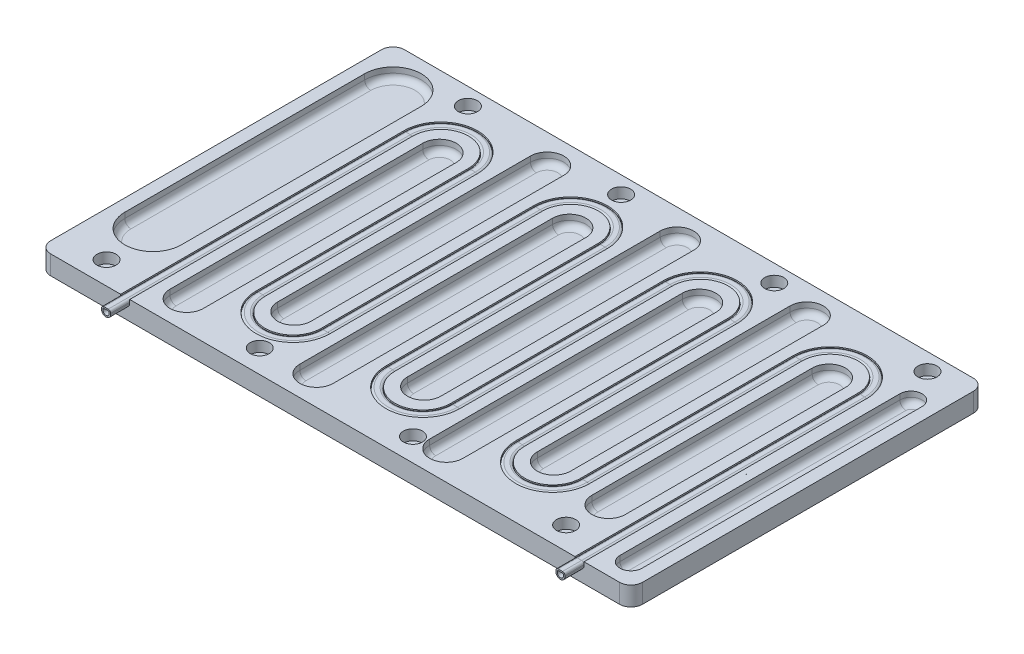
from build123d import *

# Parameters (mm, degrees)
SKETCH1_W                      = 310
SKETCH1_H                      = 185.3
BOSS_EXTRUDE1_DEPTH            = 10
CBORE_FOR_M5_SHCS1_D           = 5.5
CBORE_FOR_M5_SHCS1_CBORE_D     = 10
CBORE_FOR_M5_SHCS1_CBORE_DEPTH = 5.5
FILLET1_R                      = 6
CUT_EXTRUDE1_DEPTH             = 6
FILLET2_R                      = 3.175


with BuildPart() as part:
    # Sketch1 → Boss-Extrude1 (new body)
    with BuildSketch(Plane(origin=(0, 0, 0), x_dir=(1, 0, 0), z_dir=(0, 1, 0))):
        Rectangle(SKETCH1_W, SKETCH1_H)
    extrude(amount=BOSS_EXTRUDE1_DEPTH)

    # CBORE for M5 SHCS1 (through all)
    with Locations(Plane(origin=(0, 10, 0), x_dir=(1, 0, 0), z_dir=(0, 1, 0))):
        with Locations((-131.75, -80.65), (-106.75, 83.65), (-26.5, 83.65), (53.75, 83.65), (134, 83.65), (-51.5, -80.65), (28.75, -80.65), (109, -80.65)):
            CounterBoreHole(CBORE_FOR_M5_SHCS1_D / 2, CBORE_FOR_M5_SHCS1_CBORE_D / 2, CBORE_FOR_M5_SHCS1_CBORE_DEPTH)

    # Fillet1
    fillet1_edges = [part.edges().sort_by_distance(p)[0] for p in [
        (155, 5, -92.65),
        (155, 5, 92.65),
        (-155, 5, -92.65),
        (-155, 5, 92.65),
    ]]
    fillet(fillet1_edges, radius=FILLET1_R)

    # Cut-Sweep1: sweep along a path in Sketch6
    with BuildLine(Plane(origin=(0, 10, 0), x_dir=(1, 0, 0), z_dir=(0, 1, 0))) as cut_sweep1_path:
        Line((-110, -102.65), (-110, -92.65))
        Line((-110, -92.65), (-110, 55.65))
        ThreePointArc((-110, 55.65), (-93, 72.65), (-76, 55.65))
        Line((-76, 55.65), (-76, -55.65))
        ThreePointArc((-76, -55.65), (-59, -72.65), (-42, -55.65))
        Line((-42, -55.65), (-42, 55.65))
        ThreePointArc((-42, 55.65), (-25, 72.65), (-8, 55.65))
        Line((-8, 55.65), (-8, -55.65))
        ThreePointArc((-8, -55.65), (9, -72.65), (26, -55.65))
        Line((26, -55.65), (26, 55.65))
        ThreePointArc((26, 55.65), (43, 72.65), (60, 55.65))
        Line((60, 55.65), (60, -55.65))
        ThreePointArc((60, -55.65), (77, -72.65), (94, -55.65))
        Line((94, -55.65), (94, 55.65))
        ThreePointArc((94, 55.65), (111, 72.65), (128, 55.65))
        Line((128, 55.65), (128, -92.65))
        Line((128, -92.65), (128, -102.65))
    # Sketch7 → Cut-Sweep1 (sweep, cut)
    with BuildSketch(Plane.XY.offset(92.65)):
        with BuildLine():
            Line((-112.38125, 8.2), (-112.38125, 10))
            Line((-112.38125, 10), (-107.61875, 10))
            Line((-107.61875, 10), (-107.61875, 8.2))
            ThreePointArc((-107.61875, 8.2), (-110, 5.81875), (-112.38125, 8.2))
        make_face()
    sweep(path=cut_sweep1_path.line, mode=Mode.SUBTRACT)

    # Sketch9 → Cut-Extrude1 (cut)
    with BuildSketch(Plane(origin=(0, 10, 0), x_dir=(1, 0, 0), z_dir=(0, 1, 0))):
        with BuildLine():
            Line((-148.5, 71.340625), (-148.5, -54.340625))
            ThreePointArc((-148.5, -54.340625), (-133.690625, -69.15), (-118.88125, -54.340625))
            Line((-118.88125, -54.340625), (-118.88125, 71.340625))
            ThreePointArc((-118.88125, 71.340625), (-133.690625, 86.15), (-148.5, 71.340625))
        make_face()
        with BuildLine():
            Line((-101.75, 55.01875), (-101.75, -77.4))
            ThreePointArc((-101.75, -77.4), (-93, -86.15), (-84.25, -77.4))
            Line((-84.25, -77.4), (-84.25, 55.01875))
            ThreePointArc((-84.25, 55.01875), (-93, 63.76875), (-101.75, 55.01875))
        make_face()
        with BuildLine():
            Line((-67.75, 77.4), (-67.75, -55.01875))
            ThreePointArc((-67.75, -55.01875), (-59, -63.76875), (-50.25, -55.01875))
            Line((-50.25, -55.01875), (-50.25, 77.4))
            ThreePointArc((-50.25, 77.4), (-59, 86.15), (-67.75, 77.4))
        make_face()
        with BuildLine():
            Line((-33.75, -77.4), (-33.75, 55.01875))
            ThreePointArc((-33.75, 55.01875), (-25, 63.76875), (-16.25, 55.01875))
            Line((-16.25, 55.01875), (-16.25, -77.4))
            ThreePointArc((-16.25, -77.4), (-25, -86.15), (-33.75, -77.4))
        make_face()
        with BuildLine():
            Line((0.25, 77.4), (0.25, -55.01875))
            ThreePointArc((0.25, -55.01875), (9, -63.76875), (17.75, -55.01875))
            Line((17.75, -55.01875), (17.75, 77.4))
            ThreePointArc((17.75, 77.4), (9, 86.15), (0.25, 77.4))
        make_face()
        with BuildLine():
            Line((34.25, -77.4), (34.25, 55.01875))
            ThreePointArc((34.25, 55.01875), (43, 63.76875), (51.75, 55.01875))
            Line((51.75, 55.01875), (51.75, -77.4))
            ThreePointArc((51.75, -77.4), (43, -86.15), (34.25, -77.4))
        make_face()
        with BuildLine():
            Line((68.25, 77.4), (68.25, -55.01875))
            ThreePointArc((68.25, -55.01875), (77, -63.76875), (85.75, -55.01875))
            Line((85.75, -55.01875), (85.75, 77.4))
            ThreePointArc((85.75, 77.4), (77, 86.15), (68.25, 77.4))
        make_face()
        with BuildLine():
            Line((102.25, -60.4), (102.25, 55.01875))
            ThreePointArc((102.25, 55.01875), (111, 63.76875), (119.75, 55.01875))
            Line((119.75, 55.01875), (119.75, -60.4))
            ThreePointArc((119.75, -60.4), (111, -69.15), (102.25, -60.4))
        make_face()
        with BuildLine():
            Line((136.88125, 66.340625), (136.88125, -80.340625))
            ThreePointArc((136.88125, -80.340625), (142.690625, -86.15), (148.5, -80.340625))
            Line((148.5, -80.340625), (148.5, 66.340625))
            ThreePointArc((148.5, 66.340625), (142.690625, 72.15), (136.88125, 66.340625))
        make_face()
    extrude(amount=-CUT_EXTRUDE1_DEPTH, mode=Mode.SUBTRACT)

    # Fillet2
    fillet2_edges = [part.edges().sort_by_distance(p)[0] for p in [
        (148.5, 4, 7),
        (142.690625, 4, 86.15),
        (136.88125, 4, 7),
        (142.690625, 4, -72.15),
        (102.25, 4, 2.690625),
        (111, 4, -63.76875),
        (119.75, 4, 2.690625),
        (111, 4, 69.15),
        (85.75, 4, -11.190625),
        (77, 4, 63.76875),
        (68.25, 4, -11.190625),
        (77, 4, -86.15),
        (34.25, 4, 11.190625),
        (43, 4, -63.76875),
        (51.75, 4, 11.190625),
        (43, 4, 86.15),
        (17.75, 4, -11.190625),
        (9, 4, 63.76875),
        (0.25, 4, -11.190625),
        (9, 4, -86.15),
        (-33.75, 4, 11.190625),
        (-25, 4, -63.76875),
        (-16.25, 4, 11.190625),
        (-25, 4, 86.15),
        (-50.25, 4, -11.190625),
        (-59, 4, 63.76875),
        (-67.75, 4, -11.190625),
        (-59, 4, -86.15),
        (-84.25, 4, 11.190625),
        (-93, 4, 86.15),
        (-101.75, 4, 11.190625),
        (-93, 4, -63.76875),
        (-118.88125, 4, -8.5),
        (-133.690625, 4, 69.15),
        (-148.5, 4, -8.5),
        (-133.690625, 4, -86.15),
    ]]
    fillet(fillet2_edges, radius=FILLET2_R)


with BuildPart() as body_2:
    # Sweep1: sweep along a path in Sketch6<2>
    with BuildLine(Plane(origin=(0, 10, 0), x_dir=(1, 0, 0), z_dir=(0, 1, 0))) as sweep1_path:
        Line((-110, -102.65), (-110, -92.65))
        Line((-110, -92.65), (-110, 55.65))
        ThreePointArc((-110, 55.65), (-93, 72.65), (-76, 55.65))
        Line((-76, 55.65), (-76, -55.65))
        ThreePointArc((-76, -55.65), (-59, -72.65), (-42, -55.65))
        Line((-42, -55.65), (-42, 55.65))
        ThreePointArc((-42, 55.65), (-25, 72.65), (-8, 55.65))
        Line((-8, 55.65), (-8, -55.65))
        ThreePointArc((-8, -55.65), (9, -72.65), (26, -55.65))
        Line((26, -55.65), (26, 55.65))
        ThreePointArc((26, 55.65), (43, 72.65), (60, 55.65))
        Line((60, 55.65), (60, -55.65))
        ThreePointArc((60, -55.65), (77, -72.65), (94, -55.65))
        Line((94, -55.65), (94, 55.65))
        ThreePointArc((94, 55.65), (111, 72.65), (128, 55.65))
        Line((128, 55.65), (128, -92.65))
        Line((128, -92.65), (128, -102.65))
    # Sketch8 → Sweep1 (sweep)
    with BuildSketch(Plane.XY.offset(92.65)):
        with BuildLine():
            Line((-112.38125, 8.2), (-112.38125, 8.75))
            ThreePointArc((-112.38125, 8.75), (-112.015133476, 9.633883476), (-111.13125, 10))
            Line((-111.13125, 10), (-108.86875, 10))
            ThreePointArc((-108.86875, 10), (-107.984866524, 9.633883476), (-107.61875, 8.75))
            Line((-107.61875, 8.75), (-107.61875, 8.2))
            ThreePointArc((-107.61875, 8.2), (-110, 5.81875), (-112.38125, 8.2))
        make_face()
        with BuildLine():
            Line((-111.61925, 8.2), (-111.61925, 8.838))
            ThreePointArc((-111.61925, 8.838), (-111.502092712, 9.120842712), (-111.21925, 9.238))
            Line((-111.21925, 9.238), (-108.78075, 9.238))
            ThreePointArc((-108.78075, 9.238), (-108.497907288, 9.120842712), (-108.38075, 8.838))
            Line((-108.38075, 8.838), (-108.38075, 8.2))
            ThreePointArc((-108.38075, 8.2), (-110, 6.58075), (-111.61925, 8.2))
        make_face(mode=Mode.SUBTRACT)
    sweep(path=sweep1_path.line)


solid = Compound([part.part, body_2.part])
